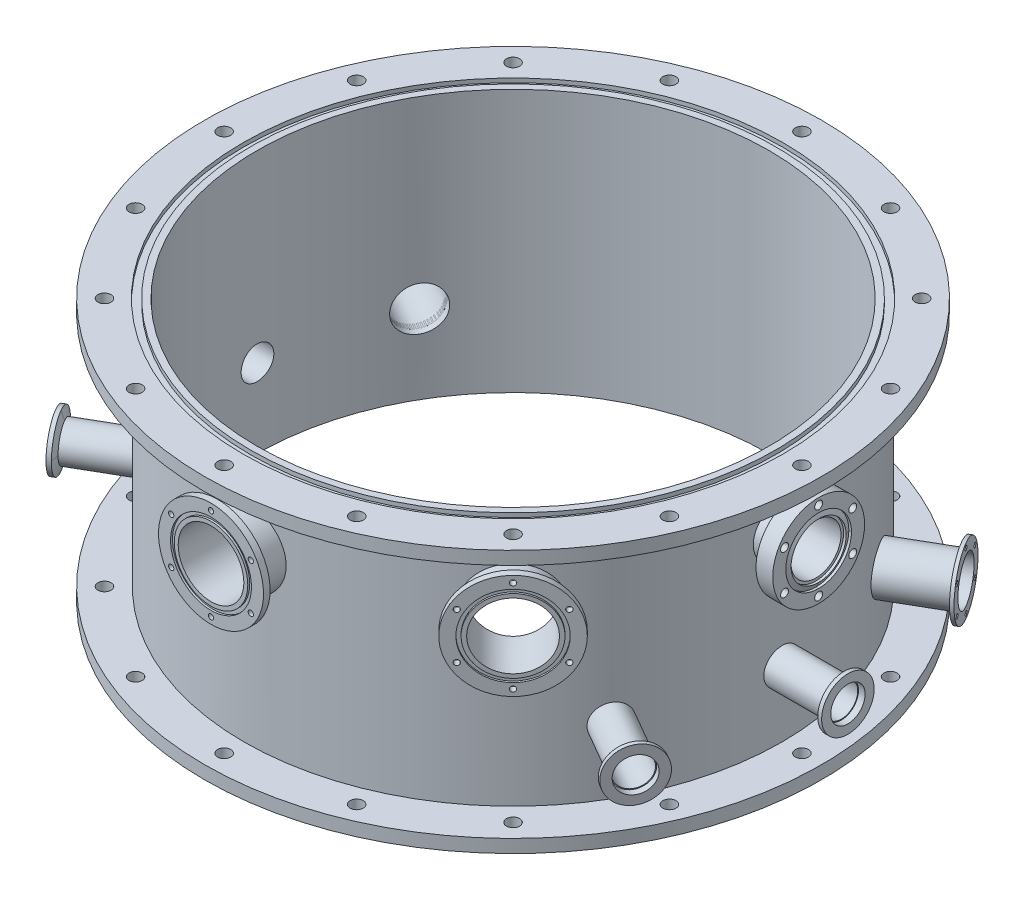
from build123d import *

# Parameters (mm, degrees)
SKETCH_1_R             = 205
SKETCH_1_R_2           = 195
EXTRUDE_1_DEPTH        = 200
SKETCH_3_R             = 235
SKETCH_3_R_2           = 5
SKETCH_3_R_3           = 205
EXTRUDE_2_DEPTH        = 10
EXTRUDE_START          = -10
SKETCH_4_R             = 235
SKETCH_4_R_2           = 5
SKETCH_4_R_3           = 205
EXTRUDE_3_DEPTH        = 10
SKETCH_7_R             = 12.45
CUT_EXTRUDE_1_DEPTH    = 225
SKETCH_8_R             = 13.6
SKETCH_8_R_2           = 12.45
EXTRUDE_4_DEPTH        = 50
SKETCH_9_R             = 20
SKETCH_9_R_2           = 13.1
EXTRUDE_5_DEPTH        = 5
SKETCH_12_R            = 16.75
CUT_EXTRUDE_2_DEPTH    = 225
SKETCH_13_R            = 17.5
SKETCH_13_R_2          = 16.75
EXTRUDE_6_DEPTH        = 50
SKETCH_14_R            = 25
SKETCH_14_R_2          = 16.75
EXTRUDE_7_DEPTH        = 2.5
SKETCH_20_R            = 12.45
CUT_EXTRUDE_3_DEPTH    = 225
SKETCH_21_R            = 13.6
SKETCH_21_R_2          = 12.45
EXTRUDE_8_DEPTH        = 50
SKETCH_22_R            = 20
SKETCH_22_R_2          = 13.1
EXTRUDE_9_DEPTH        = 5
SKETCH_25_R            = 16.75
CUT_EXTRUDE_4_DEPTH    = 225
SKETCH_26_R            = 17.5
SKETCH_26_R_2          = 16.75
EXTRUDE_10_DEPTH       = 50
SKETCH_27_R            = 25
SKETCH_27_R_2          = 16.75
EXTRUDE_11_DEPTH       = 2.5
CUT_EXTRUDE_START      = -225
SKETCH_28_R            = 12.45
CUT_EXTRUDE_5_DEPTH    = 225
EXTRUDE_START_2        = -50
SKETCH_29_R            = 13.6
SKETCH_29_R_2          = 12.45
EXTRUDE_12_DEPTH       = 50
SKETCH_30_R            = 20
SKETCH_30_R_2          = 13.1
EXTRUDE_13_DEPTH       = 5
SKETCH_33_R            = 12.45
CUT_EXTRUDE_6_DEPTH    = 225
SKETCH_34_R            = 13.6
SKETCH_34_R_2          = 12.45
EXTRUDE_14_DEPTH       = 50
SKETCH_35_R            = 20
SKETCH_35_R_2          = 13.1
EXTRUDE_15_DEPTH       = 5
SKETCH_42_R            = 25
CUT_EXTRUDE_9_DEPTH    = 225
SKETCH_43_R            = 30
SKETCH_43_R_2          = 25
EXTRUDE_18_DEPTH       = 25
SKETCH_44_R            = 40
SKETCH_44_R_2          = 30
SKETCH_44_R_3          = 25
EXTRUDE_19_DEPTH       = 5
SKETCH_45_R            = 30.8
SKETCH_45_R_2          = 28
CUT_EXTRUDE_10_DEPTH   = 1.5
SKETCH_46_R            = 19
CUT_EXTRUDE_11_DEPTH   = 225
SKETCH_47_R            = 21
SKETCH_47_R_2          = 19
EXTRUDE_20_DEPTH       = 20
EXTRUDE_21_OUTLINE_R   = 35
EXTRUDE_21_OUTLINE_R_2 = 3
EXTRUDE_21_OUTLINE_R_3 = 19
EXTRUDE_21_DEPTH       = 12.7
CUT_EXTRUDE_START_2    = -2
SKETCH_49_R            = 21
CUT_EXTRUDE_12_DEPTH   = 2
SKETCH_55_R            = 1.75
CUT_EXTRUDE_13_DEPTH   = 10
SKETCH_56_R            = 1.75
CUT_EXTRUDE_14_DEPTH   = 10
SKETCH_58_R            = 205.5
SKETCH_58_R_2          = 200
CUT_EXTRUDE_15_DEPTH   = 3.1
CUT_EXTRUDE_START_3    = -3.1
SKETCH_59_R            = 205.5
SKETCH_59_R_2          = 200
CUT_EXTRUDE_16_DEPTH   = 3.1
SKETCH_61_R            = 25
CUT_EXTRUDE_17_DEPTH   = 225
SKETCH_62_R            = 30
SKETCH_62_R_2          = 25
EXTRUDE_22_DEPTH       = 25
EXTRUDE_23_OUTLINE_R   = 40
EXTRUDE_23_OUTLINE_R_2 = 2
EXTRUDE_23_OUTLINE_R_3 = 25
EXTRUDE_23_DEPTH       = 5
SKETCH_64_R            = 30.8
SKETCH_64_R_2          = 28
CUT_EXTRUDE_18_DEPTH   = 1.5


# Read off the part's stored shape, not the designer's step: 凸台-拉伸21, 凸台-拉伸23
with BuildPart() as part:
    # 草图1 → 凸台-拉伸1 (new body)
    with BuildSketch(Plane(origin=(0, 0, 0), x_dir=(1, 0, 0), z_dir=(0, 1, 0))):
        with Locations(Location((0, 0, 0), (0, 0, 270))):
            Circle(SKETCH_1_R)
        with Locations(Location((0, 0, 0), (0, 0, 270))):
            Circle(SKETCH_1_R_2, mode=Mode.SUBTRACT)
    extrude(amount=EXTRUDE_1_DEPTH)

    # 草图3 → 凸台-拉伸2 (add)
    with BuildSketch(Plane.XZ):
        with Locations(Location((0, 0, 0), (0, 0, 270))):
            Circle(SKETCH_3_R)
        with Locations(Location((203.253497152, 84.19035512, 0), (0, 0, 270))):
            Circle(SKETCH_3_R_2, mode=Mode.SUBTRACT)
        with Locations(Location((155.563491861, 155.563491861, 0), (0, 0, 270))):
            Circle(SKETCH_3_R_2, mode=Mode.SUBTRACT)
        with Locations(Location((84.19035512, 203.253497152, 0), (0, 0, 270))):
            Circle(SKETCH_3_R_2, mode=Mode.SUBTRACT)
        with Locations(Location((0, 220, 0), (0, 0, 270))):
            Circle(SKETCH_3_R_2, mode=Mode.SUBTRACT)
        with Locations(Location((-84.19035512, 203.253497152, 0), (0, 0, 270))):
            Circle(SKETCH_3_R_2, mode=Mode.SUBTRACT)
        with Locations(Location((-155.563491861, 155.563491861, 0), (0, 0, 270))):
            Circle(SKETCH_3_R_2, mode=Mode.SUBTRACT)
        with Locations(Location((-203.253497152, 84.19035512, 0), (0, 0, 270))):
            Circle(SKETCH_3_R_2, mode=Mode.SUBTRACT)
        with Locations(Location((-220, 0, 0), (0, 0, 270))):
            Circle(SKETCH_3_R_2, mode=Mode.SUBTRACT)
        with Locations(Location((-203.253497152, -84.19035512, 0), (0, 0, 270))):
            Circle(SKETCH_3_R_2, mode=Mode.SUBTRACT)
        with Locations(Location((-155.563491861, -155.563491861, 0), (0, 0, 270))):
            Circle(SKETCH_3_R_2, mode=Mode.SUBTRACT)
        with Locations(Location((-84.19035512, -203.253497152, 0), (0, 0, 270))):
            Circle(SKETCH_3_R_2, mode=Mode.SUBTRACT)
        with Locations(Location((0, -220, 0), (0, 0, 270))):
            Circle(SKETCH_3_R_2, mode=Mode.SUBTRACT)
        with Locations(Location((84.19035512, -203.253497152, 0), (0, 0, 270))):
            Circle(SKETCH_3_R_2, mode=Mode.SUBTRACT)
        with Locations(Location((155.563491861, -155.563491861, 0), (0, 0, 270))):
            Circle(SKETCH_3_R_2, mode=Mode.SUBTRACT)
        with Locations(Location((203.253497152, -84.19035512, 0), (0, 0, 270))):
            Circle(SKETCH_3_R_2, mode=Mode.SUBTRACT)
        with Locations(Location((220, 0, 0), (0, 0, 270))):
            Circle(SKETCH_3_R_2, mode=Mode.SUBTRACT)
        with Locations(Location((0, 0, 0), (0, 0, 270))):
            Circle(SKETCH_3_R_3, mode=Mode.SUBTRACT)
    extrude(amount=-EXTRUDE_2_DEPTH)

    # 草图4 → 凸台-拉伸3 (add)
    with BuildSketch(Plane(origin=(0, 200, 0), x_dir=(1, 0, 0), z_dir=(0, 1, 0)).offset(EXTRUDE_START)):
        with Locations(Location((0, 0, 0), (0, 0, 90))):
            Circle(SKETCH_4_R)
        with Locations(Location((203.253497152, 84.19035512, 0), (0, 0, 90))):
            Circle(SKETCH_4_R_2, mode=Mode.SUBTRACT)
        with Locations(Location((155.563491861, 155.563491861, 0), (0, 0, 90))):
            Circle(SKETCH_4_R_2, mode=Mode.SUBTRACT)
        with Locations(Location((84.19035512, 203.253497152, 0), (0, 0, 90))):
            Circle(SKETCH_4_R_2, mode=Mode.SUBTRACT)
        with Locations(Location((0, 220, 0), (0, 0, 90))):
            Circle(SKETCH_4_R_2, mode=Mode.SUBTRACT)
        with Locations(Location((-84.19035512, 203.253497152, 0), (0, 0, 90))):
            Circle(SKETCH_4_R_2, mode=Mode.SUBTRACT)
        with Locations(Location((-155.563491861, 155.563491861, 0), (0, 0, 90))):
            Circle(SKETCH_4_R_2, mode=Mode.SUBTRACT)
        with Locations(Location((-203.253497152, 84.19035512, 0), (0, 0, 90))):
            Circle(SKETCH_4_R_2, mode=Mode.SUBTRACT)
        with Locations(Location((-220, 0, 0), (0, 0, 90))):
            Circle(SKETCH_4_R_2, mode=Mode.SUBTRACT)
        with Locations(Location((-203.253497152, -84.19035512, 0), (0, 0, 90))):
            Circle(SKETCH_4_R_2, mode=Mode.SUBTRACT)
        with Locations(Location((-155.563491861, -155.563491861, 0), (0, 0, 90))):
            Circle(SKETCH_4_R_2, mode=Mode.SUBTRACT)
        with Locations(Location((-84.19035512, -203.253497152, 0), (0, 0, 90))):
            Circle(SKETCH_4_R_2, mode=Mode.SUBTRACT)
        with Locations(Location((0, -220, 0), (0, 0, 90))):
            Circle(SKETCH_4_R_2, mode=Mode.SUBTRACT)
        with Locations(Location((84.19035512, -203.253497152, 0), (0, 0, 90))):
            Circle(SKETCH_4_R_2, mode=Mode.SUBTRACT)
        with Locations(Location((155.563491861, -155.563491861, 0), (0, 0, 90))):
            Circle(SKETCH_4_R_2, mode=Mode.SUBTRACT)
        with Locations(Location((203.253497152, -84.19035512, 0), (0, 0, 90))):
            Circle(SKETCH_4_R_2, mode=Mode.SUBTRACT)
        with Locations(Location((220, 0, 0), (0, 0, 90))):
            Circle(SKETCH_4_R_2, mode=Mode.SUBTRACT)
        with Locations(Location((0, 0, 0), (0, 0, 90))):
            Circle(SKETCH_4_R_3, mode=Mode.SUBTRACT)
    extrude(amount=EXTRUDE_3_DEPTH)

    # 草图7 → 切除-拉伸1 (cut)
    with BuildSketch(Plane(origin=(0, 0, 0), x_dir=(0, 0, -1), z_dir=(1, 0, 0))):
        with Locations(Location((0, 60, 0), (0, 0, 180))):
            Circle(SKETCH_7_R)
    extrude(amount=CUT_EXTRUDE_1_DEPTH, mode=Mode.SUBTRACT)

    # 草图12 → 切除-拉伸2 (cut)
    with BuildSketch(Plane(origin=(0, 0, 0), x_dir=(0.4999999999999977, 0, -0.86602540378444), z_dir=(0.86602540378444, 0, 0.4999999999999978))):
        with Locations((0, 60)):
            Circle(SKETCH_12_R)
    extrude(amount=-CUT_EXTRUDE_2_DEPTH, mode=Mode.SUBTRACT)

    # 草图20 → 切除-拉伸3 (cut)
    with BuildSketch(Plane(origin=(0, 0, 0), x_dir=(0.49999999999999806, 0, 0.8660254037844397), z_dir=(-0.8660254037844397, 0, 0.49999999999999806))):
        with Locations(Location((0, 60, 0), (0, 0, 180))):
            Circle(SKETCH_20_R)
    extrude(amount=CUT_EXTRUDE_3_DEPTH, mode=Mode.SUBTRACT)

    # 草图25 → 切除-拉伸4 (cut)
    with BuildSketch(Plane(origin=(0, 0, 0), x_dir=(0.49999999999999806, 0, 0.8660254037844397), z_dir=(-0.8660254037844397, 0, 0.49999999999999806))):
        with Locations((0, 60)):
            Circle(SKETCH_25_R)
    extrude(amount=-CUT_EXTRUDE_4_DEPTH, mode=Mode.SUBTRACT)

    # 草图26 → 凸台-拉伸10 (add)
    with BuildSketch(Plane(origin=(173.205080757, 0, -100), x_dir=(0.49999999999999806, 0, 0.8660254037844397), z_dir=(-0.8660254037844397, 0, 0.49999999999999806))):
        with Locations((0, 60)):
            Circle(SKETCH_26_R)
        with Locations((0, 60)):
            Circle(SKETCH_26_R_2, mode=Mode.SUBTRACT)
    extrude(amount=-EXTRUDE_10_DEPTH)

    # 草图27 → 凸台-拉伸11 (add)
    with BuildSketch(Plane(origin=(216.506350946, 0, -125), x_dir=(-0.49999999999999806, 0, -0.8660254037844398), z_dir=(0.8660254037844397, 0, -0.499999999999998))):
        with Locations(Location((0, 60, 0), (0, 0, 180))):
            Circle(SKETCH_27_R)
        with Locations(Location((0, 60, 0), (0, 0, 180))):
            Circle(SKETCH_27_R_2, mode=Mode.SUBTRACT)
    extrude(amount=EXTRUDE_11_DEPTH)

    # 草图28 → 切除-拉伸5 (cut)
    with BuildSketch(Plane(origin=(0, 0, 0), x_dir=(0, 0, -1), z_dir=(1, 0, 0)).offset(CUT_EXTRUDE_START)):
        with Locations((0, 60)):
            Circle(SKETCH_28_R)
    extrude(amount=CUT_EXTRUDE_5_DEPTH, mode=Mode.SUBTRACT)

    # 草图29 → 凸台-拉伸12 (add)
    with BuildSketch(Plane(origin=(-200, 0, 0), x_dir=(0, 0, -1), z_dir=(1, 0, 0)).offset(EXTRUDE_START_2)):
        with Locations((0, 60)):
            Circle(SKETCH_29_R)
        with Locations((0, 60)):
            Circle(SKETCH_29_R_2, mode=Mode.SUBTRACT)
    extrude(amount=EXTRUDE_12_DEPTH)

    # 草图30 → 凸台-拉伸13 (add)
    with BuildSketch(Plane.ZY.offset(250)):
        with Locations(Location((0, 60, 0), (0, 0, 180))):
            Circle(SKETCH_30_R)
        with Locations(Location((0, 60, 0), (0, 0, 180))):
            Circle(SKETCH_30_R_2, mode=Mode.SUBTRACT)
    extrude(amount=EXTRUDE_13_DEPTH)

    # 切除-扫描4: sweep along a curve in space
    with BuildLine() as sweep_4_path:
        ThreePointArc((-255, 60, 20), (-255, 74.142135624, 14.142135624), (-255, 80, 0))
        ThreePointArc((-255, 80, 0), (-255, 74.142135624, -14.142135624), (-255, 60, -20))
        ThreePointArc((-255, 60, -20), (-255, 45.857864376, -14.142135624), (-255, 40, 0))
        ThreePointArc((-255, 40, 0), (-255, 45.857864376, 14.142135624), (-255, 60, 20))
    # 草图32 → 切除-扫描4 (sweep, cut)
    with BuildSketch(Plane.XY):
        Polygon((-250, 80), (-252, 80), (-250, 73.6), align=None)
    sweep(path=sweep_4_path.line, mode=Mode.SUBTRACT)

    # 草图33 → 切除-拉伸6 (cut)
    with BuildSketch(Plane(origin=(0, 0, 0), x_dir=(0.4999999999999977, 0, -0.86602540378444), z_dir=(0.86602540378444, 0, 0.4999999999999978))):
        with Locations(Location((0, 60, 0), (0, 0, 180))):
            Circle(SKETCH_33_R)
    extrude(amount=CUT_EXTRUDE_6_DEPTH, mode=Mode.SUBTRACT)

    # 草图42 → 切除-拉伸9 (cut)
    with BuildSketch(Plane.XY):
        with Locations(Location((0, 140, 0), (0, 0, 180))):
            Circle(SKETCH_42_R)
    extrude(amount=CUT_EXTRUDE_9_DEPTH, mode=Mode.SUBTRACT)

    # 草图43 → 凸台-拉伸18 (add)
    with BuildSketch(Plane.XY.offset(200)):
        with Locations(Location((0, 140, 0), (0, 0, 180))):
            Circle(SKETCH_43_R)
        with Locations(Location((0, 140, 0), (0, 0, 180))):
            Circle(SKETCH_43_R_2, mode=Mode.SUBTRACT)
    extrude(amount=EXTRUDE_18_DEPTH)

    # 草图44 → 凸台-拉伸19 (add)
    # profile 1 of 3: a face of its own
    with BuildSketch(Plane.XY.offset(225)):
        with Locations((0, 140)):
            Circle(SKETCH_44_R)
        with BuildLine():
            ThreePointArc((31.26099372, 155.740084868), (34.052421208, 148.089042582), (35, 140))
            ThreePointArc((35, 140), (34.052421208, 131.910957418), (31.26099372, 124.259915132))
            ThreePointArc((31.26099372, 124.259915132), (32.028475983, 123.524644042), (32.310889132, 122.5))
            ThreePointArc((32.310889132, 122.5), (31.286040957, 120.753838805), (29.261810213, 120.797227725))
            ThreePointArc((29.261810213, 120.797227725), (17.5, 109.689110868), (1.999183507, 105.057142857))
            ThreePointArc((1.999183507, 105.057142857), (1.999795866, 105.028574345), (2, 105))
            ThreePointArc((2, 105), (-0.028574345, 103.000204134), (-1.999183507, 105.057142857))
            ThreePointArc((-1.999183507, 105.057142857), (-17.5, 109.689110868), (-29.261810213, 120.797227725))
            ThreePointArc((-29.261810213, 120.797227725), (-32.04293994, 121.5), (-31.26099372, 124.259915132))
            ThreePointArc((-31.26099372, 124.259915132), (-35, 140), (-31.26099372, 155.740084868))
            ThreePointArc((-31.26099372, 155.740084868), (-32.04293994, 158.5), (-29.261810213, 159.202772275))
            ThreePointArc((-29.261810213, 159.202772275), (-17.5, 170.310889132), (-1.999183507, 174.942857143))
            ThreePointArc((-1.999183507, 174.942857143), (-0.028574345, 176.999795866), (2, 175))
            ThreePointArc((2, 175), (1.999795866, 174.971425655), (1.999183507, 174.942857143))
            ThreePointArc((1.999183507, 174.942857143), (17.5, 170.310889132), (29.261810213, 159.202772275))
            ThreePointArc((29.261810213, 159.202772275), (31.286040957, 159.246161195), (32.310889132, 157.5))
            ThreePointArc((32.310889132, 157.5), (32.028475983, 156.475355958), (31.26099372, 155.740084868))
        make_face(mode=Mode.SUBTRACT)
    # profile 2 of 3: a face of its own
    with BuildSketch(Plane.XY.offset(225)):
        with BuildLine():
            ThreePointArc((31.26099372, 124.259915132), (34.052421208, 131.910957418), (35, 140))
            ThreePointArc((35, 140), (34.052421208, 148.089042582), (31.26099372, 155.740084868))
            ThreePointArc((31.26099372, 155.740084868), (28.578838325, 156.5), (29.261810213, 159.202772275))
            ThreePointArc((29.261810213, 159.202772275), (17.5, 170.310889132), (1.999183507, 174.942857143))
            ThreePointArc((1.999183507, 174.942857143), (0, 173), (-1.999183507, 174.942857143))
            ThreePointArc((-1.999183507, 174.942857143), (-17.5, 170.310889132), (-29.261810213, 159.202772275))
            ThreePointArc((-29.261810213, 159.202772275), (-28.564727937, 158.475151824), (-28.310889132, 157.5))
            ThreePointArc((-28.310889132, 157.5), (-29.286245091, 155.78241315), (-31.26099372, 155.740084868))
            ThreePointArc((-31.26099372, 155.740084868), (-35, 140), (-31.26099372, 124.259915132))
            ThreePointArc((-31.26099372, 124.259915132), (-29.286245091, 124.21758685), (-28.310889132, 122.5))
            ThreePointArc((-28.310889132, 122.5), (-28.564727937, 121.524848176), (-29.261810213, 120.797227725))
            ThreePointArc((-29.261810213, 120.797227725), (-17.5, 109.689110868), (-1.999183507, 105.057142857))
            ThreePointArc((-1.999183507, 105.057142857), (0, 107), (1.999183507, 105.057142857))
            ThreePointArc((1.999183507, 105.057142857), (17.5, 109.689110868), (29.261810213, 120.797227725))
            ThreePointArc((29.261810213, 120.797227725), (28.578838325, 123.5), (31.26099372, 124.259915132))
        make_face()
        with Locations(Location((0, 140, 0), (0, 0, 180))):
            Circle(SKETCH_44_R_2, mode=Mode.SUBTRACT)
    # profile 3 of 3: a face of its own
    with BuildSketch(Plane.XY.offset(225)):
        with Locations(Location((0, 140, 0), (0, 0, 180))):
            Circle(SKETCH_44_R_2)
        with Locations(Location((0, 140, 0), (0, 0, 180))):
            Circle(SKETCH_44_R_3, mode=Mode.SUBTRACT)
    extrude(amount=EXTRUDE_19_DEPTH)

    # 草图45 → 切除-拉伸10 (cut)
    with BuildSketch(Plane.XY.offset(230)):
        with Locations((0, 140)):
            Circle(SKETCH_45_R)
        with Locations((0, 140)):
            Circle(SKETCH_45_R_2, mode=Mode.SUBTRACT)
    extrude(amount=-CUT_EXTRUDE_10_DEPTH, mode=Mode.SUBTRACT)

    # 草图46 → 切除-拉伸11 (cut)
    with BuildSketch(Plane(origin=(0, 0, 0), x_dir=(0, 0, -1), z_dir=(1, 0, 0))):
        with Locations(Location((0, 150, 0), (0, 0, 180))):
            Circle(SKETCH_46_R)
    extrude(amount=CUT_EXTRUDE_11_DEPTH, mode=Mode.SUBTRACT)

    # 草图47 → 凸台-拉伸20 (add)
    with BuildSketch(Plane(origin=(200, 0, 0), x_dir=(0, 0, -1), z_dir=(1, 0, 0))):
        with Locations(Location((0, 150, 0), (0, 0, 180))):
            Circle(SKETCH_47_R)
        with Locations(Location((0, 150, 0), (0, 0, 180))):
            Circle(SKETCH_47_R_2, mode=Mode.SUBTRACT)
    extrude(amount=EXTRUDE_20_DEPTH)

    # 凸台-拉伸21 outline → 凸台-拉伸21 (add)
    with BuildSketch(Plane(origin=(220, 0, 0), x_dir=(0, 0, -1), z_dir=(1, 0, 0))):
        with Locations((0, 150)):
            Circle(EXTRUDE_21_OUTLINE_R)
        with Locations((-25.980762114, 135)):
            Circle(EXTRUDE_21_OUTLINE_R_2, mode=Mode.SUBTRACT)
        with Locations((0, 120)):
            Circle(EXTRUDE_21_OUTLINE_R_2, mode=Mode.SUBTRACT)
        with Locations((25.980762114, 135)):
            Circle(EXTRUDE_21_OUTLINE_R_2, mode=Mode.SUBTRACT)
        with Locations((-25.980762114, 165)):
            Circle(EXTRUDE_21_OUTLINE_R_2, mode=Mode.SUBTRACT)
        with Locations((0, 150)):
            Circle(EXTRUDE_21_OUTLINE_R_3, mode=Mode.SUBTRACT)
        with Locations((25.980762114, 165)):
            Circle(EXTRUDE_21_OUTLINE_R_2, mode=Mode.SUBTRACT)
        with Locations((0, 180)):
            Circle(EXTRUDE_21_OUTLINE_R_2, mode=Mode.SUBTRACT)
    extrude(amount=EXTRUDE_21_DEPTH)

    # 草图49 → 切除-拉伸12 (cut)
    with BuildSketch(Plane(origin=(232.7, 0, 0), x_dir=(0, 0, -1), z_dir=(1, 0, 0)).offset(CUT_EXTRUDE_START_2)):
        with Locations(Location((0, 150, 0), (0, 0, 180))):
            Circle(SKETCH_49_R)
    extrude(amount=CUT_EXTRUDE_12_DEPTH, mode=Mode.SUBTRACT)

    # 切除-扫描6: sweep along a curve in space
    with BuildLine() as sweep_6_path:
        ThreePointArc((232.7, 150, -21), (232.7, 164.849242405, -14.849242405), (232.7, 171, 0))
        ThreePointArc((232.7, 171, 0), (232.7, 164.849242405, 14.849242405), (232.7, 150, 21))
        ThreePointArc((232.7, 150, 21), (232.7, 135.150757595, 14.849242405), (232.7, 129, 0))
        ThreePointArc((232.7, 129, 0), (232.7, 135.150757595, -14.849242405), (232.7, 150, -21))
    # 草图51 → 切除-扫描6 (sweep, cut)
    with BuildSketch(Plane.XY):
        Polygon((232.7, 125), (230.7, 125), (232.7, 129), align=None)
    sweep(path=sweep_6_path.line, mode=Mode.SUBTRACT)

    # 草图55 → 切除-拉伸13 (cut)
    with BuildSketch(Plane(origin=(218.671414456, 0, -126.25), x_dir=(-0.4999999999999982, 0, -0.8660254037844397), z_dir=(0.8660254037844398, 0, -0.4999999999999983))):
        with Locations((0, 81.5)):
            Circle(SKETCH_55_R)
        with Locations((18.619546181, 70.75)):
            Circle(SKETCH_55_R)
        with Locations((18.619546181, 49.25)):
            Circle(SKETCH_55_R)
        with Locations((0, 38.5)):
            Circle(SKETCH_55_R)
        with Locations((-18.619546181, 49.25)):
            Circle(SKETCH_55_R)
        with Locations((-18.619546181, 70.75)):
            Circle(SKETCH_55_R)
    extrude(amount=-CUT_EXTRUDE_13_DEPTH, mode=Mode.SUBTRACT)

    # 草图58 → 切除-拉伸15 (cut)
    with BuildSketch(Plane.XZ):
        with Locations(Location((0, 0, 0), (0, 0, 270))):
            Circle(SKETCH_58_R)
        with Locations(Location((0, 0, 0), (0, 0, 270))):
            Circle(SKETCH_58_R_2, mode=Mode.SUBTRACT)
    extrude(amount=-CUT_EXTRUDE_15_DEPTH, mode=Mode.SUBTRACT)

    # 草图59 → 切除-拉伸16 (cut)
    with BuildSketch(Plane(origin=(0, 200, 0), x_dir=(1, 0, 0), z_dir=(0, 1, 0)).offset(CUT_EXTRUDE_START_3)):
        with Locations(Location((0, 0, 0), (0, 0, 90))):
            Circle(SKETCH_59_R)
        with Locations(Location((0, 0, 0), (0, 0, 90))):
            Circle(SKETCH_59_R_2, mode=Mode.SUBTRACT)
    extrude(amount=CUT_EXTRUDE_16_DEPTH, mode=Mode.SUBTRACT)

    # 草图61 → 切除-拉伸17 (cut)
    with BuildSketch(Plane(origin=(0, 0, 0), x_dir=(0.7071067811865487, 0, -0.7071067811865465), z_dir=(0.7071067811865465, 0, 0.7071067811865487))):
        with Locations(Location((0, 140, 0), (0, 0, 180))):
            Circle(SKETCH_61_R)
    extrude(amount=CUT_EXTRUDE_17_DEPTH, mode=Mode.SUBTRACT)

    # 草图62 → 凸台-拉伸22 (add)
    with BuildSketch(Plane(origin=(141.421356237, 0, 141.421356237), x_dir=(0.7071067811865487, 0, -0.7071067811865465), z_dir=(0.7071067811865465, 0, 0.7071067811865487))):
        with Locations(Location((0, 140, 0), (0, 0, 180))):
            Circle(SKETCH_62_R)
        with Locations(Location((0, 140, 0), (0, 0, 180))):
            Circle(SKETCH_62_R_2, mode=Mode.SUBTRACT)
    extrude(amount=EXTRUDE_22_DEPTH)

    # 凸台-拉伸23 outline → 凸台-拉伸23 (add)
    with BuildSketch(Plane(origin=(159.099025767, 0, 159.099025767), x_dir=(0.7071067811865486, 0, -0.7071067811865465), z_dir=(0.7071067811865465, 0, 0.7071067811865486))):
        with Locations((0, 140)):
            Circle(EXTRUDE_23_OUTLINE_R)
        with Locations((-30.310889132, 122.5)):
            Circle(EXTRUDE_23_OUTLINE_R_2, mode=Mode.SUBTRACT)
        with Locations((0, 105)):
            Circle(EXTRUDE_23_OUTLINE_R_2, mode=Mode.SUBTRACT)
        with Locations((30.310889132, 122.5)):
            Circle(EXTRUDE_23_OUTLINE_R_2, mode=Mode.SUBTRACT)
        with Locations((-30.310889132, 157.5)):
            Circle(EXTRUDE_23_OUTLINE_R_2, mode=Mode.SUBTRACT)
        with Locations((0, 140)):
            Circle(EXTRUDE_23_OUTLINE_R_3, mode=Mode.SUBTRACT)
        with Locations((30.310889132, 157.5)):
            Circle(EXTRUDE_23_OUTLINE_R_2, mode=Mode.SUBTRACT)
        with Locations((0, 175)):
            Circle(EXTRUDE_23_OUTLINE_R_2, mode=Mode.SUBTRACT)
    extrude(amount=EXTRUDE_23_DEPTH)

    # 草图64 → 切除-拉伸18 (cut)
    with BuildSketch(Plane(origin=(162.634559673, 0, 162.634559673), x_dir=(0.7071067811865485, 0, -0.7071067811865467), z_dir=(0.7071067811865467, 0, 0.7071067811865485))):
        with Locations((0, 140)):
            Circle(SKETCH_64_R)
        with Locations((0, 140)):
            Circle(SKETCH_64_R_2, mode=Mode.SUBTRACT)
    extrude(amount=-CUT_EXTRUDE_18_DEPTH, mode=Mode.SUBTRACT)


with BuildPart() as body_2:
    # 草图8 → 凸台-拉伸4 (new body)
    with BuildSketch(Plane(origin=(200, 0, 0), x_dir=(0, 0, -1), z_dir=(1, 0, 0))):
        with Locations((0, 60)):
            Circle(SKETCH_8_R)
        with Locations((0, 60)):
            Circle(SKETCH_8_R_2, mode=Mode.SUBTRACT)
    extrude(amount=EXTRUDE_4_DEPTH)

    # 草图9 → 凸台-拉伸5 (add)
    with BuildSketch(Plane(origin=(250, 0, 0), x_dir=(0, 0, -1), z_dir=(1, 0, 0))):
        with Locations((0, 60)):
            Circle(SKETCH_9_R)
        with Locations((0, 60)):
            Circle(SKETCH_9_R_2, mode=Mode.SUBTRACT)
    extrude(amount=EXTRUDE_5_DEPTH)

    # 切除-扫描1: sweep along a curve in space
    with BuildLine() as sweep_1_path:
        ThreePointArc((255, 60, -20), (255, 74.142135624, -14.142135624), (255, 80, 0))
        ThreePointArc((255, 80, 0), (255, 74.142135624, 14.142135624), (255, 60, 20))
        ThreePointArc((255, 60, 20), (255, 45.857864376, 14.142135624), (255, 40, 0))
        ThreePointArc((255, 40, 0), (255, 45.857864376, -14.142135624), (255, 60, -20))
    # 草图16 → 切除-扫描1 (sweep, cut)
    with BuildSketch(Plane(origin=(0, 0, 0), x_dir=(0, -1, 0), z_dir=(0, 0, 1))):
        Polygon((-80, 252), (-73.6, 250), (-80, 250), align=None)
    sweep(path=sweep_1_path.line, mode=Mode.SUBTRACT)


with BuildPart() as body_3:
    # 草图13 → 凸台-拉伸6 (new body)
    with BuildSketch(Plane(origin=(-173.205080757, 0, -100), x_dir=(0.4999999999999977, 0, -0.86602540378444), z_dir=(0.86602540378444, 0, 0.4999999999999978))):
        with Locations((0, 60)):
            Circle(SKETCH_13_R)
        with Locations((0, 60)):
            Circle(SKETCH_13_R_2, mode=Mode.SUBTRACT)
    extrude(amount=-EXTRUDE_6_DEPTH)

    # 草图14 → 凸台-拉伸7 (add)
    with BuildSketch(Plane(origin=(-216.506350946, 0, -125), x_dir=(-0.49999999999999784, 0, 0.86602540378444), z_dir=(-0.86602540378444, 0, -0.49999999999999784))):
        with Locations((0, 60)):
            Circle(SKETCH_14_R)
        with Locations(Location((0, 60, 0), (0, 0, 180))):
            Circle(SKETCH_14_R_2, mode=Mode.SUBTRACT)
    extrude(amount=EXTRUDE_7_DEPTH)

    # 草图56 → 切除-拉伸14 (cut)
    with BuildSketch(Plane(origin=(-218.671414456, 0, -126.25), x_dir=(-0.4999999999999979, 0, 0.8660254037844399), z_dir=(-0.8660254037844398, 0, -0.49999999999999784))):
        with Locations((0, 81.5)):
            Circle(SKETCH_56_R)
        with Locations((18.619546181, 70.75)):
            Circle(SKETCH_56_R)
        with Locations((18.619546181, 49.25)):
            Circle(SKETCH_56_R)
        with Locations((0, 38.5)):
            Circle(SKETCH_56_R)
        with Locations((-18.619546181, 49.25)):
            Circle(SKETCH_56_R)
        with Locations((-18.619546181, 70.75)):
            Circle(SKETCH_56_R)
    extrude(amount=-CUT_EXTRUDE_14_DEPTH, mode=Mode.SUBTRACT)


with BuildPart() as body_4:
    # 草图21 → 凸台-拉伸8 (new body)
    with BuildSketch(Plane(origin=(-173.205080757, 0, 100), x_dir=(0.49999999999999806, 0, 0.8660254037844397), z_dir=(-0.8660254037844397, 0, 0.49999999999999806))):
        with Locations((0, 60)):
            Circle(SKETCH_21_R)
        with Locations((0, 60)):
            Circle(SKETCH_21_R_2, mode=Mode.SUBTRACT)
    extrude(amount=EXTRUDE_8_DEPTH)

    # 草图22 → 凸台-拉伸9 (add)
    with BuildSketch(Plane(origin=(-216.506350946, 0, 125), x_dir=(0.49999999999999806, 0, 0.8660254037844398), z_dir=(-0.8660254037844397, 0, 0.499999999999998))):
        with Locations(Location((0, 60, 0), (0, 0, 180))):
            Circle(SKETCH_22_R)
        with Locations(Location((0, 60, 0), (0, 0, 180))):
            Circle(SKETCH_22_R_2, mode=Mode.SUBTRACT)
    extrude(amount=EXTRUDE_9_DEPTH)

    # 切除-扫描3: sweep along a curve in space
    with BuildLine() as sweep_3_path:
        ThreePointArc((-210.836477965, 60, 144.820508076), (-213.765410153, 74.142135624, 139.747448714), (-220.836477965, 80, 127.5))
        ThreePointArc((-220.836477965, 80, 127.5), (-227.907545777, 74.142135624, 115.252551286), (-230.836477965, 60, 110.179491924))
        ThreePointArc((-230.836477965, 60, 110.179491924), (-227.907545777, 45.857864376, 115.252551286), (-220.836477965, 40, 127.5))
        ThreePointArc((-220.836477965, 40, 127.5), (-213.765410153, 45.857864376, 139.747448714), (-210.836477965, 60, 144.820508076))
    # 草图24 → 切除-扫描3 (sweep, cut)
    with BuildSketch(Plane(origin=(0, 0, 0), x_dir=(0, -1, 0), z_dir=(-0.49999999999999806, 0, -0.8660254037844397))):
        Polygon((-80, 252), (-73.6, 250), (-80, 250), align=None)
    sweep(path=sweep_3_path.line, mode=Mode.SUBTRACT)


with BuildPart() as body_5:
    # 草图34 → 凸台-拉伸14 (new body)
    with BuildSketch(Plane(origin=(173.205080757, 0, 100), x_dir=(0.4999999999999977, 0, -0.86602540378444), z_dir=(0.86602540378444, 0, 0.4999999999999978))):
        with Locations((0, 60)):
            Circle(SKETCH_34_R)
        with Locations((0, 60)):
            Circle(SKETCH_34_R_2, mode=Mode.SUBTRACT)
    extrude(amount=EXTRUDE_14_DEPTH)

    # 草图35 → 凸台-拉伸15 (add)
    with BuildSketch(Plane(origin=(216.506350946, 0, 125), x_dir=(0.49999999999999784, 0, -0.86602540378444), z_dir=(0.86602540378444, 0, 0.49999999999999784))):
        with Locations((0, 60)):
            Circle(SKETCH_35_R)
        with Locations((0, 60)):
            Circle(SKETCH_35_R_2, mode=Mode.SUBTRACT)
    extrude(amount=EXTRUDE_15_DEPTH)

    # 切除-扫描5: sweep along a curve in space
    with BuildLine() as sweep_5_path:
        ThreePointArc((230.836477965, 60, 110.179491924), (227.907545777, 74.142135624, 115.252551286), (220.836477965, 80, 127.5))
        ThreePointArc((220.836477965, 80, 127.5), (213.765410153, 74.142135624, 139.747448714), (210.836477965, 60, 144.820508076))
        ThreePointArc((210.836477965, 60, 144.820508076), (213.765410153, 45.857864376, 139.747448714), (220.836477965, 40, 127.5))
        ThreePointArc((220.836477965, 40, 127.5), (227.907545777, 45.857864376, 115.252551286), (230.836477965, 60, 110.179491924))
    # 草图37 → 切除-扫描5 (sweep, cut)
    with BuildSketch(Plane(origin=(0, 0, 0), x_dir=(0, -1, 0), z_dir=(-0.4999999999999978, 1.3115741796592249e-15, 0.86602540378444))):
        Polygon((-80, 250), (-80, 252), (-73.6, 250), align=None)
    sweep(path=sweep_5_path.line, mode=Mode.SUBTRACT)


solid = Compound([part.part, body_2.part, body_3.part, body_4.part, body_5.part])
